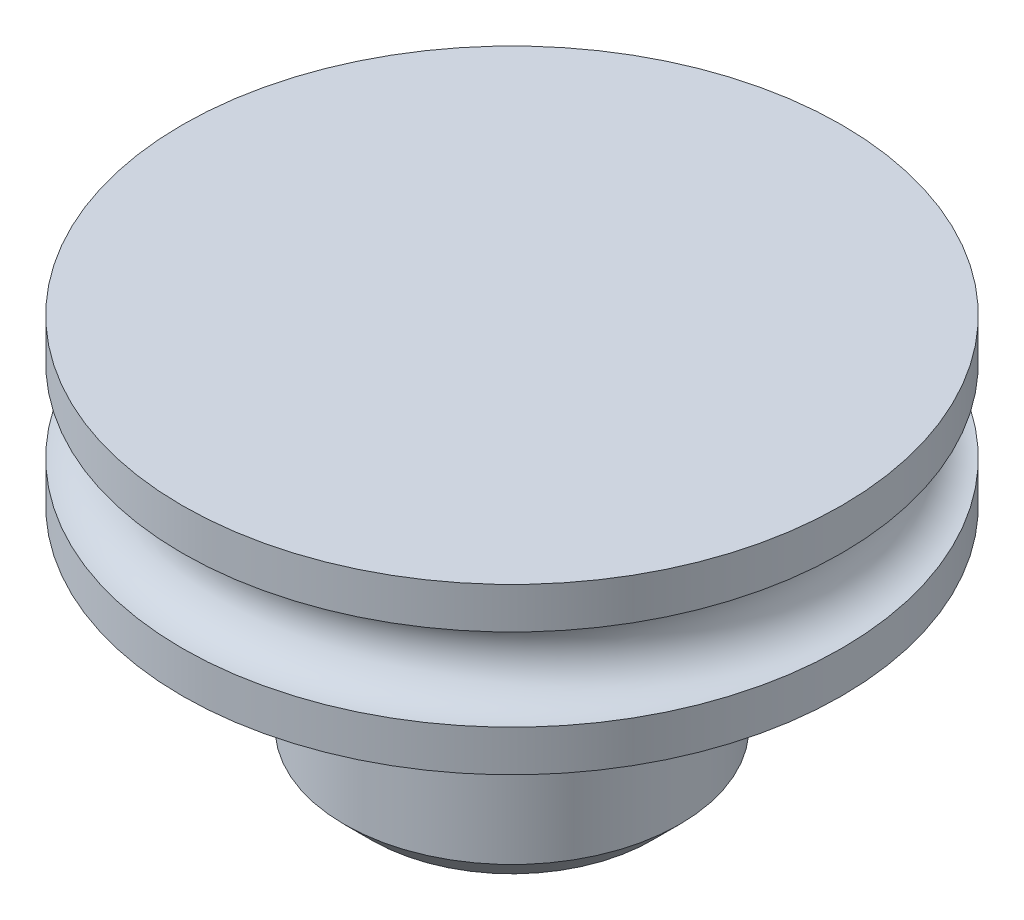
from build123d import *

# Parameters (mm, degrees)
SKETCH1_R           = 3.05
BOSS_EXTRUDE1_DEPTH = 3
SKETCH4_R           = 3.6
BOSS_EXTRUDE3_DEPTH = 1
SKETCH2_R           = 6
BOSS_EXTRUDE2_DEPTH = 3
SKETCH3_R           = 0.75
CHAMFER1_SIZE       = 0.5


with BuildPart() as part:
    # Sketch1 → Boss-Extrude1 (new body)
    with BuildSketch(Plane(origin=(0, 0, 0), x_dir=(1, 0, 0), z_dir=(0, 1, 0))):
        Circle(SKETCH1_R)
    extrude(amount=BOSS_EXTRUDE1_DEPTH)

    # Sketch4 → Boss-Extrude3 (add)
    with BuildSketch(Plane(origin=(0, 3, 0), x_dir=(1, 0, 0), z_dir=(0, 1, 0))):
        Circle(SKETCH4_R)
    extrude(amount=BOSS_EXTRUDE3_DEPTH)

    # Sketch2 → Boss-Extrude2 (add)
    with BuildSketch(Plane(origin=(0, 4, 0), x_dir=(1, 0, 0), z_dir=(0, 1, 0))):
        Circle(SKETCH2_R)
    extrude(amount=BOSS_EXTRUDE2_DEPTH)

    # Sketch3 → Cut-Revolve1 (revolve, cut)
    with BuildSketch(Plane.XY):
        with Locations((-6, 5.5)):
            Circle(SKETCH3_R)
    revolve(axis=Axis((0, 9.115200414, 0), (0, -1, 0)), mode=Mode.SUBTRACT)

    # Chamfer1
    chamfer1_edges = [part.edges().sort_by_distance(p)[0] for p in [
        (-3.05, 0, 0),
    ]]
    chamfer(chamfer1_edges, length=CHAMFER1_SIZE)


solid = part.part
